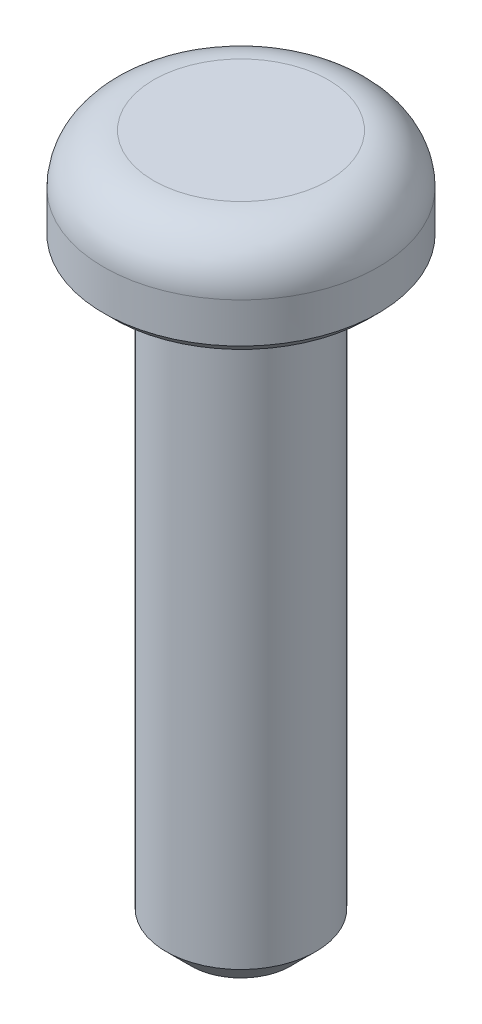
from build123d import *

# Parameters (mm, degrees)
FILLET1_R     = 1
CHAMFER1_SIZE = 0.5
CHAMFER2_SIZE = 0.2


with BuildPart() as part:
    # Sketch1 → Revolve1 (revolve)
    with BuildSketch(Plane.XY):
        Polygon((0, 0), (0, 14), (2.75, 14), (2.75, 12), (1.5, 12), (1.5, 0), align=None)
    revolve(axis=Axis((0, 0, 0), (0, 1, 0)))

    # Fillet1
    fillet1_edges = [part.edges().sort_by_distance(p)[0] for p in [
        (-2.75, 14, 0),
    ]]
    fillet(fillet1_edges, radius=FILLET1_R)

    # Chamfer1
    chamfer1_edges = [part.edges().sort_by_distance(p)[0] for p in [
        (-1.5, 0, 0),
    ]]
    chamfer(chamfer1_edges, length=CHAMFER1_SIZE)

    # Chamfer2
    chamfer2_edges = [part.edges().sort_by_distance(p)[0] for p in [
        (-2.75, 12, 0),
    ]]
    chamfer(chamfer2_edges, length=CHAMFER2_SIZE)


solid = part.part
